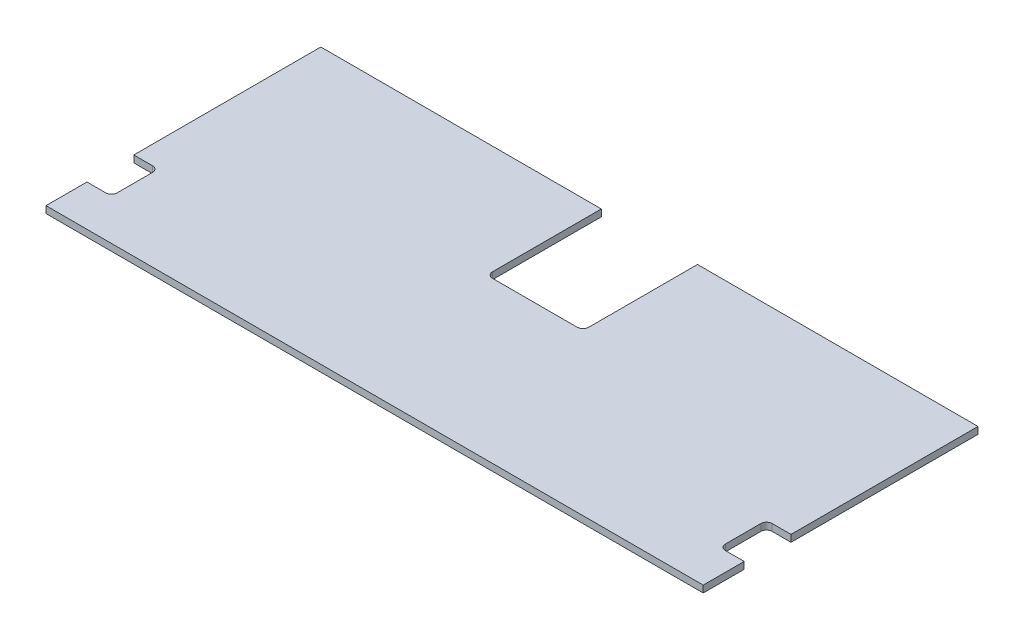
from build123d import *

# Parameters (mm, degrees)
SKETCH1_W           = 287
SKETCH1_H           = 120
BOSS_EXTRUDE1_DEPTH = 3
SKETCH2_W           = 10.697211584
SKETCH2_H           = 20.454336607
CUT_EXTRUDE1_DEPTH  = 156.567509461
FILLET1_R           = 2.5


with BuildPart() as part:
    # Sketch1 → Boss-Extrude1 (new body)
    with BuildSketch(Plane(origin=(0, 0, 0), x_dir=(1, 0, 0), z_dir=(0, 1, 0))):
        Rectangle(SKETCH1_W, SKETCH1_H)
    extrude(amount=BOSS_EXTRUDE1_DEPTH)

    # Sketch2 → Cut-Extrude1 (cut, through all)
    with BuildSketch(Plane(origin=(0, 3, 0), x_dir=(1, 0, 0), z_dir=(0, 1, 0))):
        Polygon((-21, 10), (21, 10), (21, 52), (21, 60), (-21, 60), (-21, 52), align=None)
        with Locations((138.151394208, -31.884701183)):
            Rectangle(SKETCH2_W, SKETCH2_H)
        with Locations((-138.151394208, -31.884701183)):
            Rectangle(SKETCH2_W, SKETCH2_H)
    extrude(amount=-CUT_EXTRUDE1_DEPTH, mode=Mode.SUBTRACT)

    # Fillet1
    fillet1_edges = [part.edges().sort_by_distance(p)[0] for p in [
        (-21, 1.5, -10),
        (21, 1.5, -10),
        (132.802788416, 1.5, 42.111869486),
        (132.802788416, 1.5, 21.657532879),
        (-132.802788416, 1.5, 42.111869486),
        (-132.802788416, 1.5, 21.657532879),
    ]]
    fillet(fillet1_edges, radius=FILLET1_R)


solid = part.part
